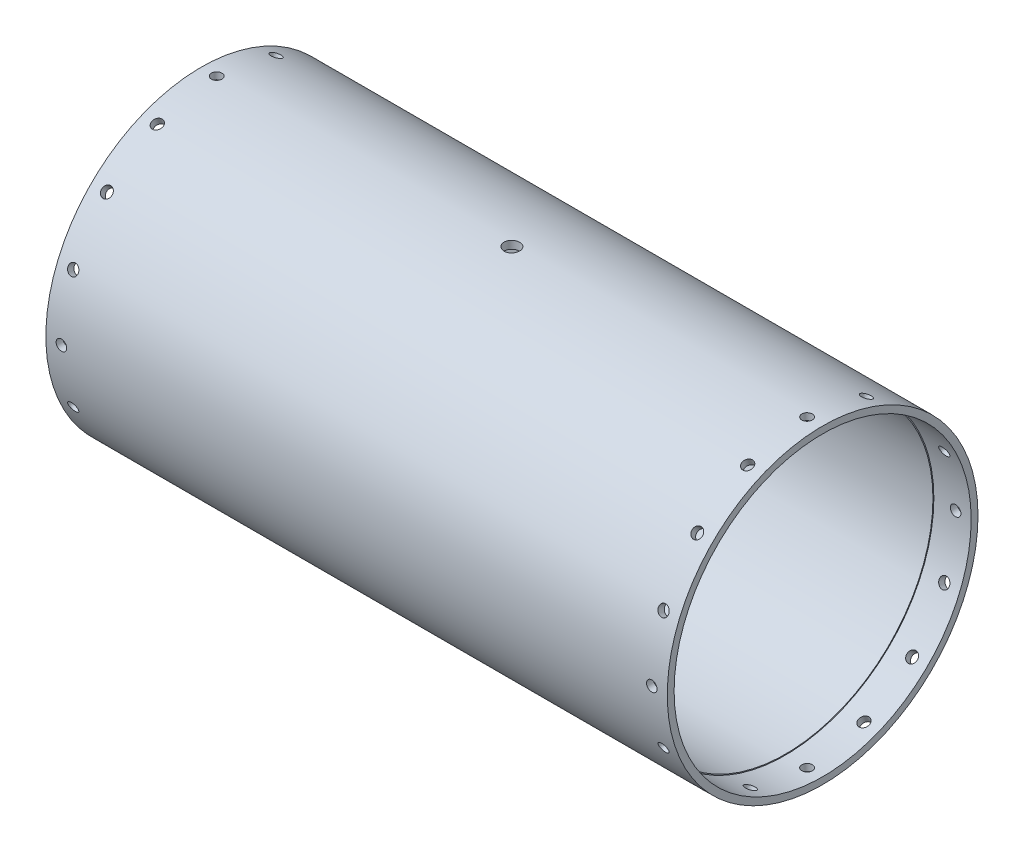
from build123d import *

# Parameters (mm, degrees)
SKETCH1_R                  = 63.5
SKETCH1_R_2                = 60.325
BOSS_EXTRUDE1_DEPTH        = 254
F_6_CLEARANCE_HOLE1_REACH  = 287.468
F_6_CLEARANCE_HOLE1_BORE_R = 2.15265
CIRPATTERN1_COUNT          = 16
CUT_EXTRUDE1_DEPTH         = 270.40768378
CUT_EXTRUDE1_DEPTH_BACK    = 270.40768378
SKETCH3_R                  = 3.175
SKETCH5_R                  = 60.706
CUT_EXTRUDE2_DEPTH         = 15.24
CUT_EXTRUDE3_START         = -15.24
SKETCH6_R                  = 60.706
CUT_EXTRUDE3_DEPTH         = 15.24


with BuildPart() as part:
    # Sketch1 → Boss-Extrude1 (new body)
    with BuildSketch(Plane(origin=(0, 0, 0), x_dir=(0, 0, -1), z_dir=(1, 0, 0))):
        Circle(SKETCH1_R)
        Circle(SKETCH1_R_2, mode=Mode.SUBTRACT)
    extrude(amount=BOSS_EXTRUDE1_DEPTH)

    # #6 Clearance Hole1 bore (on position points) → #6 Clearance Hole1 (cut, up to next)
    with BuildSketch(Plane(origin=(6.35, 63.5, 0), x_dir=(0, 0, 1), z_dir=(0, 1, 0)), mode=Mode.PRIVATE) as f_6_clearance_hole1_sk1:
        Circle(F_6_CLEARANCE_HOLE1_BORE_R)
    f_6_clearance_hole1_tool1 = extrude(f_6_clearance_hole1_sk1.sketch, amount=-F_6_CLEARANCE_HOLE1_REACH, mode=Mode.PRIVATE) & part.part
    # #6 Clearance Hole1 bore (on position points) → #6 Clearance Hole1 (cut, up to next)
    with BuildSketch(Plane(origin=(6.35, 63.5, 0), x_dir=(0, 0, 1), z_dir=(0, 1, 0)), mode=Mode.PRIVATE) as f_6_clearance_hole1_sk2:
        with Locations((0, 241.3)):
            Circle(F_6_CLEARANCE_HOLE1_BORE_R)
    f_6_clearance_hole1_tool2 = extrude(f_6_clearance_hole1_sk2.sketch, amount=-F_6_CLEARANCE_HOLE1_REACH, mode=Mode.PRIVATE) & part.part
    f_6_clearance_hole1_1 = f_6_clearance_hole1_tool1.solids().sort_by_distance((6.35, 63.5, 0))[0]
    add(f_6_clearance_hole1_1, mode=Mode.SUBTRACT)
    f_6_clearance_hole1_2 = f_6_clearance_hole1_tool2.solids().sort_by_distance((247.65, 63.5, 0))[0]
    add(f_6_clearance_hole1_2, mode=Mode.SUBTRACT)
    f_6_clearance_hole1 = f_6_clearance_hole1_1 + f_6_clearance_hole1_2  # #6 Clearance Hole1 as one shape, for the pattern or mirror that repeats it

    # CirPattern1: #6 Clearance Hole1 ×16 about axis
    cirpattern1_axis = Axis((254, 0, 0), (-1, 0, 0))
    for i in range(1, CIRPATTERN1_COUNT):
        add(f_6_clearance_hole1.rotate(cirpattern1_axis, i * 360 / CIRPATTERN1_COUNT), mode=Mode.SUBTRACT)

    # Sketch3 → Cut-Extrude1 (cut, two sides: drawn at the far end of the back side and taken through both)
    with BuildSketch(Plane(origin=(0, 0, 0), x_dir=(1, 0, 0), z_dir=(0, 1, 0)).offset(-CUT_EXTRUDE1_DEPTH_BACK)):
        with Locations(Location((127, 0, 0), (0, 0, 270))):
            Circle(SKETCH3_R)
    extrude(amount=CUT_EXTRUDE1_DEPTH + CUT_EXTRUDE1_DEPTH_BACK, mode=Mode.SUBTRACT)

    # Sketch5 → Cut-Extrude2 (cut)
    with BuildSketch(Plane.ZY):
        Circle(SKETCH5_R)
    extrude(amount=-CUT_EXTRUDE2_DEPTH, mode=Mode.SUBTRACT)

    # Sketch6 → Cut-Extrude3 (cut)
    with BuildSketch(Plane(origin=(254, 0, 0), x_dir=(0, 0, -1), z_dir=(1, 0, 0)).offset(CUT_EXTRUDE3_START)):
        with Locations(Location((0, 0, 0), (0, 0, 180))):
            Circle(SKETCH6_R)
    extrude(amount=CUT_EXTRUDE3_DEPTH, mode=Mode.SUBTRACT)


solid = part.part
